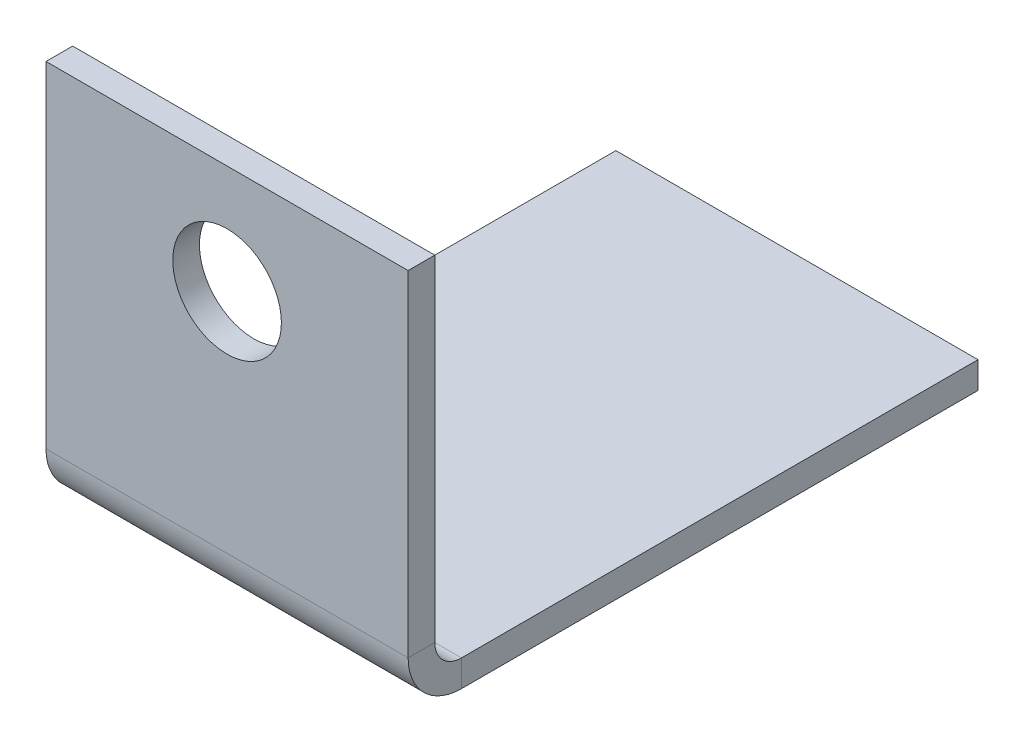
from build123d import *

# Parameters (mm, degrees)
CROQUIS1_W                       = 10
CROQUIS1_H                       = 15
BRIDA_BASE1_DEPTH                = 0.7366
BRIDA_DE_ARISTA1_STRIP_W         = 4.4196
BRIDA_DE_ARISTA1_STRIP_H         = 0.7366
BRIDA_DE_ARISTA1_STRIP_CUT_DEPTH = 10
BRIDA_DE_ARISTA1_DEPTH           = 10
CROQUIS7_R                       = 1.5
CORTAR_EXTRUIR1_DEPTH            = 10


# Sheet-metal steps are written as plain solids
with BuildPart() as part:
    # Croquis1 → Brida base1 (new body)
    with BuildSketch(Plane(origin=(0, 0, 0), x_dir=(1, 0, 0), z_dir=(0, 1, 0))):
        Rectangle(CROQUIS1_W, CROQUIS1_H)
    extrude(amount=-BRIDA_BASE1_DEPTH)

    # Brida de arista1 strip (across the edge) → Brida de arista1 strip cut (cut)
    with BuildSketch(Plane(origin=(-5, 0, 7.5), x_dir=(0, 0, -1), z_dir=(1, 0, 0))):
        with Locations((-1.4732, -0.3683)):
            Rectangle(BRIDA_DE_ARISTA1_STRIP_W, BRIDA_DE_ARISTA1_STRIP_H)
    extrude(amount=BRIDA_DE_ARISTA1_STRIP_CUT_DEPTH, mode=Mode.SUBTRACT)

    # Brida de arista1 section (across the edge) → Brida de arista1 (add)
    with BuildSketch(Plane(origin=(-5, 0, 7.5), x_dir=(0, 0, -1), z_dir=(1, 0, 0))):
        with BuildLine():
            Line((-0.7366, 0.7366), (-0.7366, 10))
            Line((-0.7366, 10), (0, 10))
            Line((0, 10), (0, 0.7366))
            ThreePointArc((0, 0.7366), (0.215745145, 0.215745145), (0.7366, 0))
            Line((0.7366, 0), (0.7366, -0.7366))
            ThreePointArc((0.7366, -0.7366), (-0.30510971, -0.30510971), (-0.7366, 0.7366))
        make_face()
    extrude(amount=BRIDA_DE_ARISTA1_DEPTH)

    # Croquis7 → Cortar-Extruir1 (cut)
    with BuildSketch(Plane.XY.offset(8.2366)):
        with Locations((0, 7)):
            Circle(CROQUIS7_R)
    extrude(amount=-CORTAR_EXTRUIR1_DEPTH, mode=Mode.SUBTRACT)


solid = part.part
